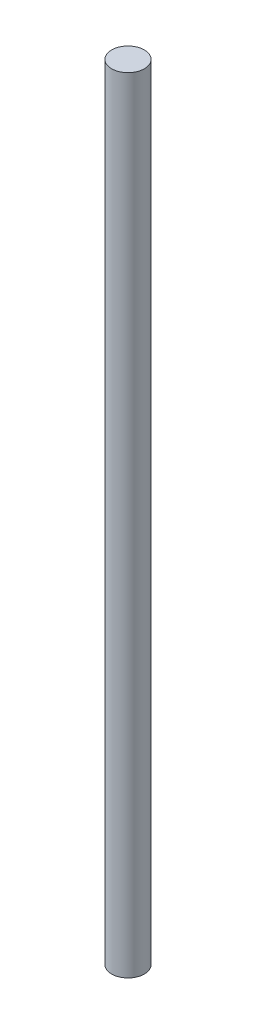
from build123d import *

# Parameters (mm, degrees)
SKETCH1_R           = 12.7
BOSS_EXTRUDE1_DEPTH = 609.6


with BuildPart() as part:
    # Sketch1 → Boss-Extrude1 (new body)
    with BuildSketch(Plane(origin=(0, 0, 0), x_dir=(1, 0, 0), z_dir=(0, 1, 0))):
        Circle(SKETCH1_R)
    extrude(amount=BOSS_EXTRUDE1_DEPTH)


solid = part.part
